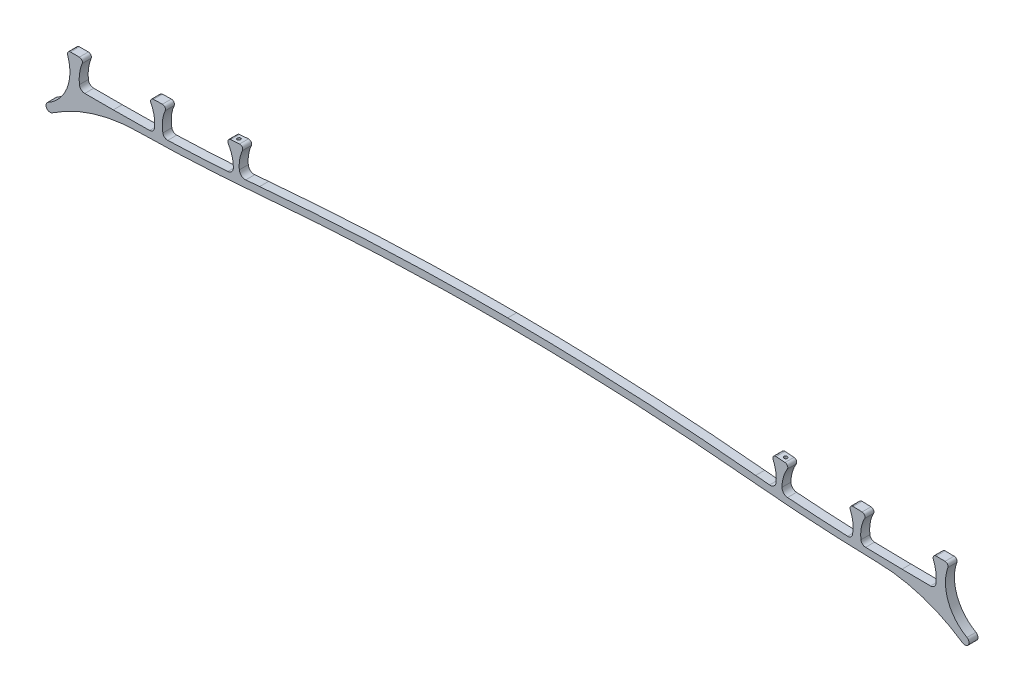
from build123d import *

# Parameters (mm, degrees)
BOSS_EXTRUDE5_DEPTH = 4.7625
SKETCH6_R           = 1.778
CUT_EXTRUDE3_DEPTH  = 504.733086563
CUT_EXTRUDE4_START  = 3.556
SKETCH7_R           = 3.048
SKETCH7_R_2         = 1.778
CUT_EXTRUDE4_DEPTH  = 505.502600354


with BuildPart() as part:
    # Sketch1 → Boss-Extrude5 (new, symmetric)
    with BuildSketch(Plane(origin=(0, 0, 4.097149242), x_dir=(-1, 0, 0), z_dir=(0, 0, -1))):
        with BuildLine():
            Line((4.980483945, -43.087244707), (5.013364858, -50.687454907))
            add(Edge.make_bspline(
                [(266.801551376, -61.551589611), (261.350884009, -61.078554924), (250.433518448, -60.153958667), (228.701217873, -58.434486699), (190.548987698, -55.763104255), (136.042529388, -52.86929541), (81.4824687, -51.236835025), (43.240954482, -50.737883821), (21.43842692, -50.650632415), (10.483916541, -50.667450636), (5.013364858, -50.687454907)],
                knots=[4.0417e-05, 4.0417e-05, 4.0417e-05, 4.0417e-05, 0.062531963, 0.125023508, 0.2500066, 0.499972783, 0.749938966, 0.874922057, 0.937413603, 0.999905149, 0.999905149, 0.999905149, 0.999905149], degree=3))
            add(Edge.make_bspline(
                [(398.35171036, -68.196818162), (396.265786035, -68.16801087), (352.35609282, -67.485074441), (308.459309619, -65.190615284), (266.801551376, -61.551589611)],
                knots=[0.388247103, 0.388247103, 0.388247103, 0.388247103, 0.401472843, 0.666666775, 0.666666775, 0.666666775, 0.666666775], degree=3))
            ThreePointArc((398.35171036, -68.196818162), (445.202941045, -75.692238551), (487.961522574, -96.257326662))
            ThreePointArc((487.961522574, -96.257326662), (494.102034598, -94.922101367), (492.499924864, -88.845757162))
            ThreePointArc((492.499924864, -88.845757162), (472.347982204, -65.669309605), (471.824439099, -34.961421092))
            ThreePointArc((471.824439099, -34.961421092), (471.408544547, -32.082865726), (468.823110549, -30.750731982))
            Line((468.823110549, -30.750731982), (464.060610549, -30.750731982))
            Line((464.060610549, -30.750731982), (459.298110549, -30.750731982))
            ThreePointArc((459.298110549, -30.750731982), (456.664489609, -32.15241144), (456.356218194, -35.119840174))
            ThreePointArc((456.356218194, -35.119840174), (459.13228847, -45.417631786), (459.332762362, -56.081162557))
            ThreePointArc((459.332762362, -56.081162557), (457.466080253, -59.753283819), (453.620807365, -61.230731982))
            Line((453.620807365, -61.230731985), (423.379813153, -61.230732209))
            add(Edge.make_bspline(
                [(384.69669435, -60.817291115), (385.490946639, -60.834366328), (398.38358415, -61.102948795), (411.282715888, -61.232192999), (423.379813153, -61.230732209)],
                knots=[0.584578013, 0.584578013, 0.584578013, 0.584578013, 0.589634714, 0.666658831, 0.666658831, 0.666658831, 0.666658831], degree=3))
            ThreePointArc((384.69669435, -60.817291115), (381.405012075, -59.519394431), (379.749008052, -56.392517605))
            ThreePointArc((379.749008052, -56.392517605), (379.962938882, -45.344267983), (383.481055682, -34.868942675))
            ThreePointArc((383.481055682, -34.868942675), (383.390574332, -31.793909155), (380.736068027, -30.23904122))
            add(Edge.make_bspline(
                [(380.736068027, -30.23904122), (377.567706075, -30.162607104), (374.399550345, -30.077611409), (371.231646974, -29.984054972)],
                knots=[0.564351213, 0.564351213, 0.564351213, 0.564351213, 0.584873669, 0.584873669, 0.584873669, 0.584873669], degree=3))
            ThreePointArc((371.231646974, -29.984054972), (368.497589908, -31.394357521), (368.242362423, -34.460116848))
            ThreePointArc((368.242362423, -34.460116848), (371.193755284, -45.109007001), (370.814996242, -56.152834368))
            ThreePointArc((370.814996242, -56.152834368), (368.993717842, -59.186422224), (365.637179655, -60.305958598))
            add(Edge.make_bspline(
                [(301.916083239, -57.118764264), (304.793492849, -57.314159562), (316.447125042, -58.077219349), (336.889920622, -59.214945623), (355.259103098, -59.96581465), (364.843153628, -60.280423029), (365.637179655, -60.305958598)],
                knots=[0.408750601, 0.408750601, 0.408750601, 0.408750601, 0.427107919, 0.483087827, 0.539067736, 0.544124431, 0.544124431, 0.544124431, 0.544124431], degree=3))
            ThreePointArc((301.916083239, -57.118764264), (297.703900514, -55.115863145), (295.996304567, -50.7755622))
            ThreePointArc((295.996304567, -50.7755622), (297.395526272, -40.599539879), (301.466201974, -31.168800195))
            ThreePointArc((301.466201974, -31.168800195), (301.565948035, -28.066269557), (298.971867926, -26.361454603))
            add(Edge.make_bspline(
                [(289.489598636, -25.664595471), (292.649719638, -25.90542225), (295.810491414, -26.137709697), (298.971867926, -26.361454603)],
                knots=[0.377389823, 0.377389823, 0.377389823, 0.377389823, 0.397912285, 0.397912285, 0.397912285, 0.397912285], degree=3))
            ThreePointArc((289.489598636, -25.664595471), (286.640803233, -27.018955044), (286.365734252, -30.161288915))
            ThreePointArc((286.365734252, -30.161288915), (289.309950073, -39.618561113), (289.709550194, -49.515465879))
            ThreePointArc((289.709550194, -49.515465879), (287.468803622, -53.805389908), (282.855937937, -55.270266537))
            Line((282.855937937, -55.270266537), (268.113256948, -54.036580381))
            add(Edge.make_bspline(
                [(268.113256948, -54.036580381), (262.634745624, -53.56111419), (251.663313863, -52.628696852), (229.81175043, -50.89541865), (191.471827261, -48.203857237), (136.679597141, -45.286916485), (81.835702382, -43.641470214), (43.402846546, -43.138474088), (21.480818831, -43.050269737), (10.476996172, -43.067138198), (4.980483945, -43.087244707)],
                knots=[-0.002434158, -0.002434158, -0.002434158, -0.002434158, 0.060213256, 0.12286067, 0.248155497, 0.498745152, 0.749334808, 0.874629635, 0.937277049, 0.999924463, 0.999924463, 0.999924463, 0.999924463], degree=3))
        make_face()
    boss_extrude5 = extrude(amount=BOSS_EXTRUDE5_DEPTH, both=True)

    # Sketch6 → Cut-Extrude3 (cut, through all)
    with BuildSketch(Plane(origin=(0.32087569, -4.366204823, 0), x_dir=(0.9973104440526221, 0.07329309778936742, 0), z_dir=(-0.07329309778936742, 0.9973104440526221, 0))):
        with Locations((-295.980145151, -4.097149242)):
            Circle(SKETCH6_R)
    cut_extrude3 = extrude(amount=-CUT_EXTRUDE3_DEPTH, mode=Mode.SUBTRACT)

    # Sketch7 → Cut-Extrude4 (cut)
    with BuildSketch(Plane(origin=(3.065947832, -41.718823267, 0), x_dir=(-0.9946544730103679, -0.07309790847145088, 0.07293267510222654), z_dir=(-0.07329309778936742, 0.9973104440526221, 0)).offset(CUT_EXTRUDE4_START)):
        with Locations((295.490726509, -17.500385777)):
            Circle(SKETCH7_R)
        with Locations((295.490726509, -17.500385777)):
            Circle(SKETCH7_R_2, mode=Mode.SUBTRACT)
    cut_extrude4 = extrude(amount=-CUT_EXTRUDE4_DEPTH, mode=Mode.SUBTRACT)

    # Mirror4: Boss-Extrude5, Cut-Extrude3, Cut-Extrude4 across plane
    add(boss_extrude5.mirror(Plane(origin=(-4.793985166, 0.020740296, 8.859649242), x_dir=(0, 0, 1), z_dir=(-0.9999906416249494, 0.004326275825933448, 0))))
    add(cut_extrude3.mirror(Plane(origin=(-4.793985166, 0.020740296, 8.859649242), x_dir=(0, 0, 1), z_dir=(-0.9999906416249494, 0.004326275825933448, 0))), mode=Mode.SUBTRACT)
    add(cut_extrude4.mirror(Plane(origin=(-4.793985166, 0.020740296, 8.859649242), x_dir=(0, 0, 1), z_dir=(-0.9999906416249494, 0.004326275825933448, 0))), mode=Mode.SUBTRACT)


solid = part.part
